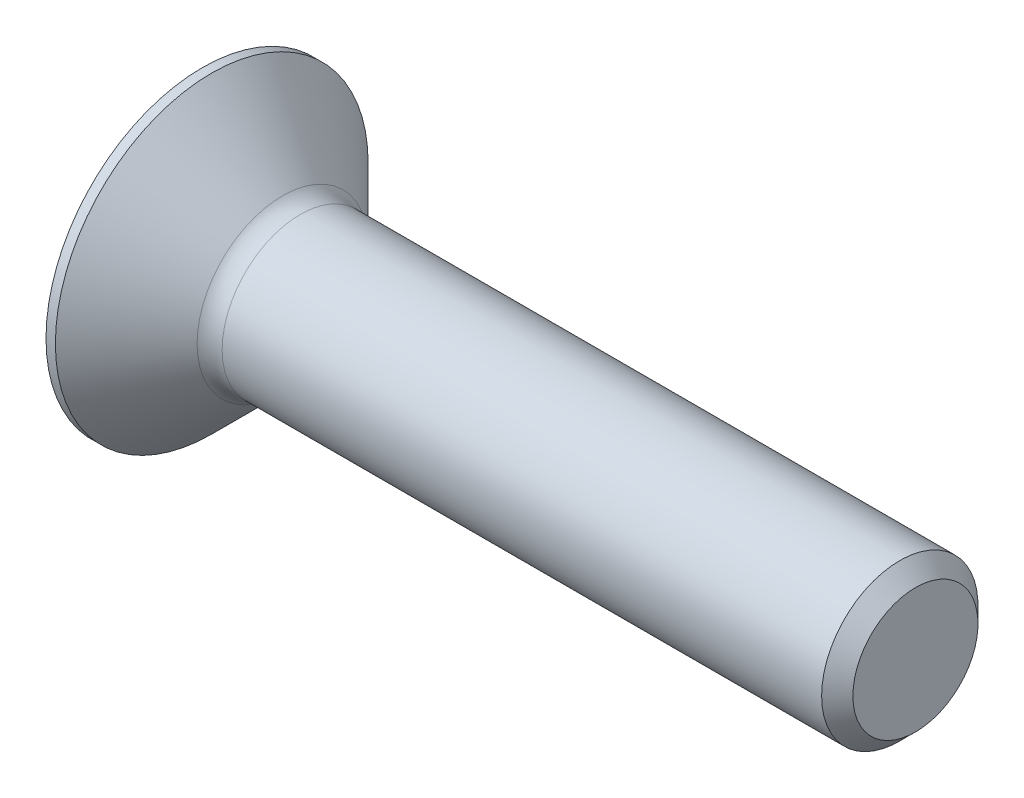
from build123d import *

# Parameters (mm, degrees)
FILLET1_R   = 0.8
HEX_2_DEPTH = 5.6


with BuildPart() as part:
    # BodySke → BaseBody (revolve)
    with BuildSketch(Plane.XY):
        Polygon((0, 0), (0, 5), (0.3, 5), (2.8, 2.5), (22.3, 2.5), (22.8, 2), (22.8, 0), align=None)
    revolve(axis=Axis((0, 0, 0), (1, 0, 0)))

    # Fillet1
    fillet1_edges = [part.edges().sort_by_distance(p)[0] for p in [
        (2.8, -2.5, 0),
    ]]
    fillet(fillet1_edges, radius=FILLET1_R)

    # Sketch2 → PreBroach (revolve, cut)
    with BuildSketch(Plane.XY):
        Polygon((0, 1.5), (3.5, 1.5), (4.366025404, 0), (0, 0), align=None)
    revolve(axis=Axis((0, 0, 0), (1, 0, 0)), mode=Mode.SUBTRACT)

    # Sketch3 → Hex 2 (cut)
    with BuildSketch(Plane.ZY):
        Polygon((-1.5, -0.866025404), (-1.5, 0.866025404), (0, 1.732050808), (1.5, 0.866025404), (1.5, -0.866025404), (0, -1.732050808), align=None)
    extrude(amount=-HEX_2_DEPTH, mode=Mode.SUBTRACT)


solid = part.part
